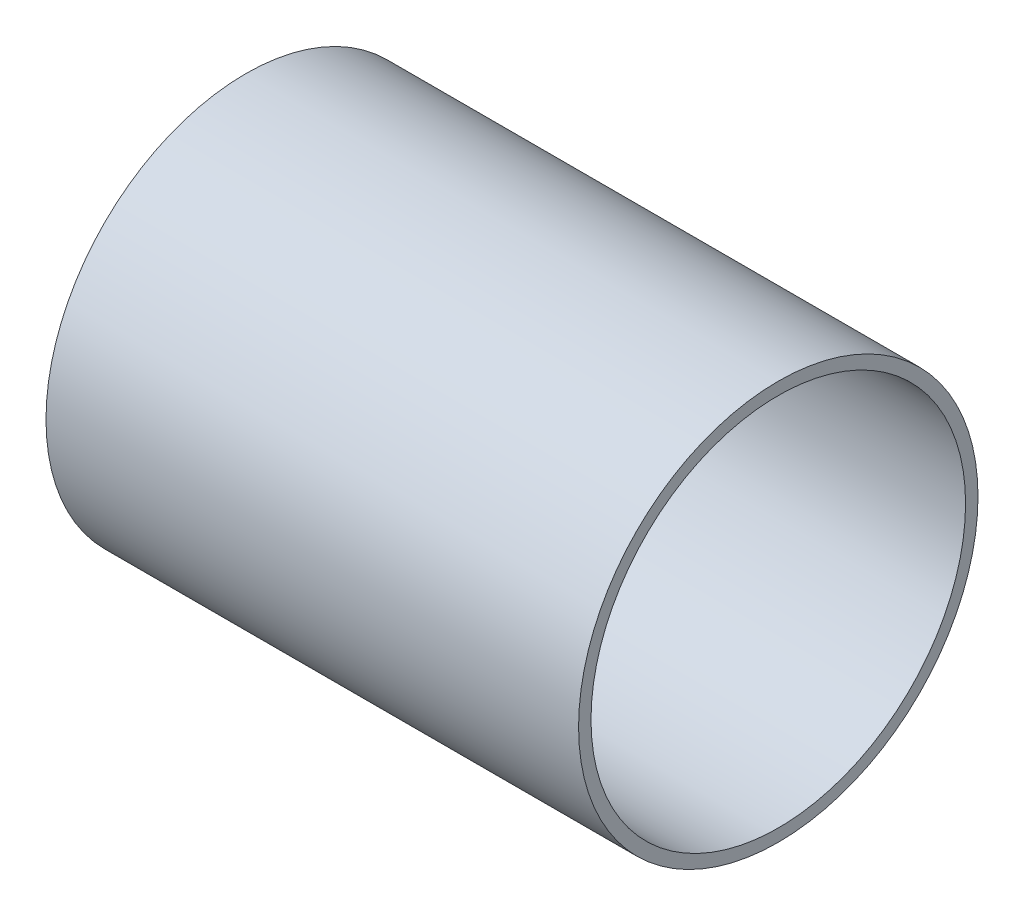
from build123d import *

# Parameters (mm, degrees)
SKETCH1_R           = 14.2875
SKETCH1_R_2         = 13.3985
BOSS_EXTRUDE1_DEPTH = 19.05


with BuildPart() as part:
    # Sketch1 → Boss-Extrude1 (new, symmetric)
    with BuildSketch(Plane(origin=(0, 0, 0), x_dir=(0, 0, -1), z_dir=(1, 0, 0))):
        Circle(SKETCH1_R)
        Circle(SKETCH1_R_2, mode=Mode.SUBTRACT)
    extrude(amount=BOSS_EXTRUDE1_DEPTH, both=True)


solid = part.part
